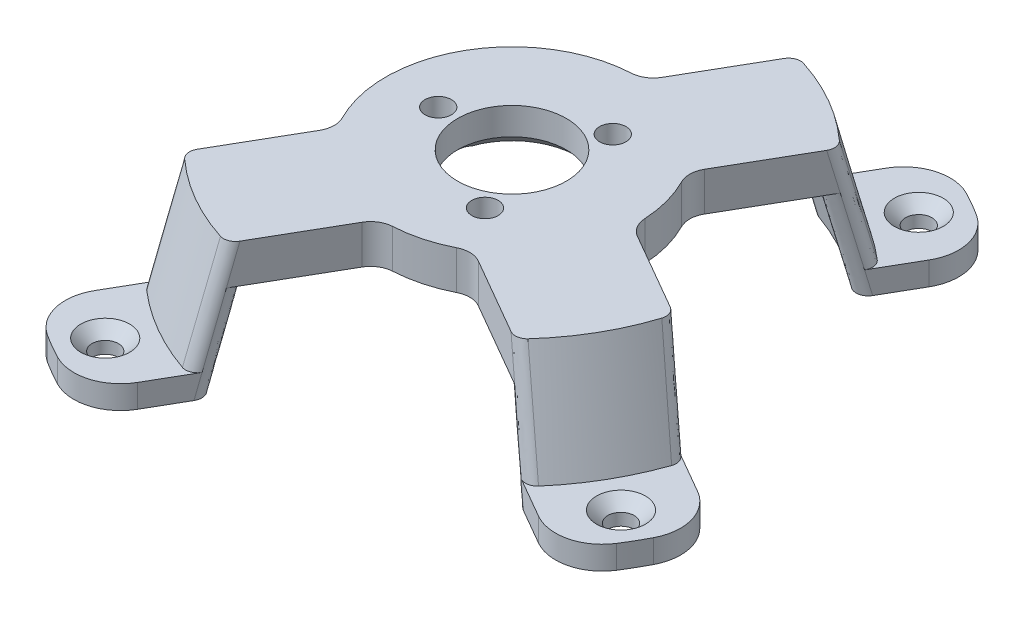
from build123d import *

# Parameters (mm, degrees)
SKETCH_2_R                   = 15.000000000000002
SKETCH_2_R_2                 = 7
EXTRUDE_1_DEPTH              = 5
SKETCH_3_R                   = 1.4999999999999987
CUT_EXTRUDE_1_DEPTH          = 5
PATTERN_CIRCULAR_1_COUNT     = 3
HOLE_WIZARD_M3_1_D           = 3.4
HOLE_WIZARD_M3_1_DEPTH       = 10
HOLE_WIZARD_M3_1_CSINK_D     = 6.3
HOLE_WIZARD_M3_1_CSINK_ANGLE = 90
HOLE_WIZARD_M3_1_TIP         = 1.0214630523468524
HOLE_WIZARD_M3_2_D           = 3.4
HOLE_WIZARD_M3_2_DEPTH       = 10
HOLE_WIZARD_M3_2_CSINK_D     = 6.3
HOLE_WIZARD_M3_2_CSINK_ANGLE = 90
HOLE_WIZARD_M3_2_TIP         = 1.0214630523468524
CUT_EXTRUDE_2_DEPTH          = 100
FILLET_1_R                   = 3
CHAMFER_1_SIZE               = 1.5
FILLET_2_R                   = 1.5
SKETCH_12_R                  = 1.5000000000000009
SKETCH_12_R_2                = 1.5000000000000042
SKETCH_12_R_3                = 1.4999999999999858
CUT_EXTRUDE_3_DEPTH          = 100
HOLE_WIZARD_M3_3_D           = 3.4
HOLE_WIZARD_M3_3_DEPTH       = 10
HOLE_WIZARD_M3_3_CSINK_D     = 6.3
HOLE_WIZARD_M3_3_CSINK_ANGLE = 90
HOLE_WIZARD_M3_3_TIP         = 1.0214630523468524
FILLET_3_R                   = 6


# Some blends are built 0.0001 mm under size
with BuildPart() as part:
    # ｽｹｯﾁ2 → ﾎﾞｽ - 押し出し1 (new body)
    with BuildSketch(Plane(origin=(0, 0, 0), x_dir=(1, 0, 0), z_dir=(0, 1, 0))):
        with Locations(Location((0, 0, 0), (0, 0, 270))):
            Circle(SKETCH_2_R)
        with Locations(Location((0, 0, 0), (0, 0, 270))):
            Circle(SKETCH_2_R_2, mode=Mode.SUBTRACT)
    extrude(amount=EXTRUDE_1_DEPTH)

    # ｽｹｯﾁ3 → ｶｯﾄ - 押し出し1 (cut)
    with BuildSketch(Plane(origin=(0, 5, 0), x_dir=(1, 0, 0), z_dir=(0, 1, 0))):
        with Locations(Location((-9.5, 0, 0), (0, 0, 270))):
            Circle(SKETCH_3_R)
    cut_extrude_1 = extrude(amount=-CUT_EXTRUDE_1_DEPTH, mode=Mode.SUBTRACT)

    # 円形ﾊﾟﾀｰﾝ1: ｶｯﾄ - 押し出し1 ×3 about axis
    pattern_circular_1_axis = Axis((4.7e-16, 0, 3.1e-16), (0, 1, 0))
    for i in range(1, PATTERN_CIRCULAR_1_COUNT):
        add(cut_extrude_1.rotate(pattern_circular_1_axis, i * 360 / PATTERN_CIRCULAR_1_COUNT), mode=Mode.SUBTRACT)

    # M3 丸皿ねじ用皿穴1
    with Locations(Plane(origin=(4.75, 0, 8.227241336), x_dir=(0, 0, -1), z_dir=(0, -1, 0))):
        with Locations((0, 0), (16.454482672, 0)):
            CounterSinkHole(HOLE_WIZARD_M3_1_D / 2, HOLE_WIZARD_M3_1_CSINK_D / 2, depth=HOLE_WIZARD_M3_1_DEPTH, counter_sink_angle=HOLE_WIZARD_M3_1_CSINK_ANGLE)
            with Locations((0, 0, -(HOLE_WIZARD_M3_1_DEPTH + HOLE_WIZARD_M3_1_TIP / 2))):  # 118° drill point
                Cone(0, HOLE_WIZARD_M3_1_D / 2, HOLE_WIZARD_M3_1_TIP, mode=Mode.SUBTRACT)

    # M3 丸皿ねじ用皿穴2
    with Locations(Plane(origin=(-9.5, 0, 0), x_dir=(0, 0, -1), z_dir=(0, -1, 0))):
        with Locations((0, 0)):
            CounterSinkHole(HOLE_WIZARD_M3_2_D / 2, HOLE_WIZARD_M3_2_CSINK_D / 2, depth=HOLE_WIZARD_M3_2_DEPTH, counter_sink_angle=HOLE_WIZARD_M3_2_CSINK_ANGLE)
            with Locations((0, 0, -(HOLE_WIZARD_M3_2_DEPTH + HOLE_WIZARD_M3_2_TIP / 2))):  # 118° drill point
                Cone(0, HOLE_WIZARD_M3_2_D / 2, HOLE_WIZARD_M3_2_TIP, mode=Mode.SUBTRACT)

    # ｽｹｯﾁ10 → 回転1 (revolve)
    with BuildSketch(Plane.XY, mode=Mode.PRIVATE) as revolve_1_sk:
        Polygon((29.841438454499965, 5.000000000000003), (15.000000000000002, 5), (15.000000000000002, 0), (28.000000000000004, 0), (31.000000000000004, -11.989999999999993), (43.34185546867846, -11.989999999999993), (43.34185546867846, -8.989999999999995), (33.341855468678446, -8.989999999999995), align=None)
    revolve(revolve_1_sk.sketch.rotate(Axis((-3.47e-15, 5, 0), (4.1e-16, -1, 0)), 180), axis=Axis((-3.47e-15, 5, 0), (4.1e-16, -1, 0)))

    # ｽｹｯﾁ11 → ｶｯﾄ - 押し出し2 (cut)
    with BuildSketch(Plane(origin=(0, 5, 0), x_dir=(1, 0, 0), z_dir=(0, 1, 0))):
        with BuildLine():
            ThreePointArc((-13.703042150052633, -8.734365222148707), (-14.072912811497138, 8.12499999999998), (0.71266109328574, 16.23436522214887))
            Line((0.7126610932858508, 16.234365222148742), (7.946601682364933, 28.763917861368522))
            ThreePointArc((7.946601682365226, 28.76391786136825), (-25.843443787066793, 14.920719227250016), (-20.936982739131317, -21.26391786136851))
            Line((-20.93698273913168, -21.26391786136839), (-13.703042150052537, -8.734365222148728))
        make_face()
        with BuildLine():
            ThreePointArc((-20.936982739131317, -21.26391786136851), (-25.843443787066793, 14.920719227250016), (7.946601682365226, 28.76391786136825))
            Line((7.946601682364933, 28.763917861368522), (14.848815863738722, 40.71890350823042))
            ThreePointArc((14.848815863738327, 40.718903508230746), (-37.53514788302896, 21.67092773433938), (-27.839196920506218, -33.218903508229914))
            Line((-27.83919692050553, -33.21890350823019), (-20.93698273913168, -21.26391786136839))
        make_face()
        with BuildLine():
            Line((27.839196920505294, 33.2189035082304), (20.936982739131395, 21.263917861368313))
            ThreePointArc((20.936982739131558, 21.263917861368263), (27.525453046829504, 11.526529555789693), (29.84143845449996, 0))
            ThreePointArc((29.84143845449996, -7.31e-15), (29.570831351215176, -4.0096611118271115), (28.76391786136822, -7.946601682365325))
            Line((28.76391786136849, -7.946601682365032), (40.71890350823052, -14.848815863738949))
            ThreePointArc((40.71890350823052, -14.848815863738949), (42.68108050509385, -7.539350262821762), (43.34185546867846, -1.062e-14))
            ThreePointArc((43.34185546867846, 0), (39.27543051807618, 18.32912963257075), (27.839196920505934, 33.21890350823016))
        make_face()
        with BuildLine():
            Line((20.936982739131395, 21.263917861368313), (13.703042150052372, 8.734365222148643))
            ThreePointArc((13.703042150052724, 8.734365222148572), (15.600271390882225, 4.54906941371767), (16.250000000000004, 0))
            ThreePointArc((16.250000000000004, -3.98e-15), (16.24609083533511, -0.35641628756369514), (16.234365222148842, -0.7126610932864834))
            Line((16.234365222149194, -0.712661093286167), (28.76391786136849, -7.946601682365032))
            ThreePointArc((28.76391786136822, -7.946601682365325), (29.570831351215176, -4.0096611118271115), (29.84143845449996, -7.31e-15))
            ThreePointArc((29.84143845449996, 0), (27.525453046829504, 11.526529555789693), (20.936982739131558, 21.263917861368263))
        make_face()
        with BuildLine():
            Line((33.218903508230504, -27.839196920505508), (21.26391786136825, -20.93698273913146))
            ThreePointArc((21.26391786136819, -20.936982739131636), (7.723532605278948, -28.824616096817355), (-7.946601682365455, -28.76391786136819))
            Line((-7.946601682365145, -28.763917861368473), (-14.848815863739018, -40.71890350823031))
            ThreePointArc((-14.848815863738585, -40.718903508230646), (11.217697645374956, -41.86501755648458), (33.218903508230504, -27.839196920505522))
        make_face()
        with BuildLine():
            Line((21.26391786136825, -20.93698273913146), (8.734365222148599, -13.7030421500524))
            ThreePointArc((8.734365222148528, -13.70304215005275), (4.2058094829155666, -15.696294677197466), (-0.7126610932863937, -16.234365222148842))
            Line((-0.7126610932861706, -16.234365222149094), (-7.946601682365145, -28.763917861368473))
            ThreePointArc((-7.946601682365455, -28.76391786136819), (7.723532605278948, -28.824616096817355), (21.26391786136819, -20.936982739131636))
        make_face()
    extrude(amount=-CUT_EXTRUDE_2_DEPTH, mode=Mode.SUBTRACT)

    # ﾌｨﾚｯﾄ1
    fillet_1_edges = [part.edges().sort_by_distance(p)[0] for p in [
        (-0.7126610932862826, 2.5, 16.234365222148966),
        (8.734365222148565, 2.5, 13.703042150052577),
        (0.7126610932857966, 2.5, -16.234365222148806),
        (-13.703042150052585, 2.5, 8.734365222148718),
        (16.23436522214902, 2.5, 0.7126610932863253),
        (13.703042150052548, 2.5, -8.734365222148607),
    ]]
    fillet(fillet_1_edges, radius=FILLET_1_R)

    # 面取り1
    # the kernel refuses this chamfer: 1.5 mm, written as the material it takes off along each edge
    with BuildSketch(Plane(origin=(0, 0, 0), x_dir=(0.7442189868674399, 0, -0.6679357001882752), z_dir=(0.6679357001882752, 0, 0.7442189868674399))) as chamfer_1_piece_1:
        Polygon((7.000000000000001, CHAMFER_1_SIZE), (7.000000000000001 + CHAMFER_1_SIZE, 0), (7.000000000000001, 0), align=None)
    revolve(axis=Axis((0, 0, 0), (0, 1, 0)), revolution_arc=156.18411921842153, mode=Mode.SUBTRACT)
    with BuildSketch(Plane(origin=(0, 0, 0), x_dir=(0.20633979101891303, 0, 0.9784803987011038), z_dir=(-0.9784803987011038, 0, 0.20633979101891303))) as chamfer_1_piece_2:
        Polygon((7, CHAMFER_1_SIZE), (7 + CHAMFER_1_SIZE, 0), (7, 0), align=None)
    revolve(axis=Axis((0, 0, 0), (0, 1, 0)), revolution_arc=156.18411921927228, mode=Mode.SUBTRACT)
    with BuildSketch(Plane(origin=(0, 0, 0), x_dir=(-0.9505825246393949, 0, -0.31047200171705375), z_dir=(0.31047200171705375, 0, -0.9505825246393949))) as chamfer_1_piece_3:
        Polygon((7.000000000000001, CHAMFER_1_SIZE), (7.000000000000001 + CHAMFER_1_SIZE, 0), (7.000000000000001, 0), align=None)
    revolve(axis=Axis((0, 0, 0), (0, 1, 0)), revolution_arc=108.08767779983522, mode=Mode.SUBTRACT)
    with BuildSketch(Plane(origin=(0, 0, 0), x_dir=(-1.8e-16, 0, 1), z_dir=(-1, 0, -1.8e-16))) as chamfer_1_piece_4:
        Polygon((7, CHAMFER_1_SIZE), (7 + CHAMFER_1_SIZE, 0), (7, 0), align=None)
    revolve(axis=Axis((0, 0, 0), (0, 1, 0)), revolution_arc=48.07893998206209, mode=Mode.SUBTRACT)

    # ﾌｨﾚｯﾄ2
    fillet_2_edges = [part.edges().sort_by_distance(p)[0] for p in [
        (-7.749054422575009, -5.83190834081924, 28.421755970515953),
        (-8.82257152167481, -1.7894546585643667, 30.28114212895074),
        (20.921755970515978, -5.831908340819197, 20.73943547934147),
        (22.78114212895078, -1.789454658564324, 21.81295257844127),
        (-20.739435479341555, -5.831908340819211, 20.921755970515893),
        (7.749054422574802, -5.831908340819183, -28.421755970516006),
        (8.8225715216746, -1.7894546585643525, -30.28114212895082),
        (-21.812952578441358, -1.7894546585642814, 22.78114212895068),
        (28.42175597051599, -5.831908340819268, 7.749054422574907),
        (30.281142128950776, -1.7894546585643667, 8.822571521674698),
        (20.739435479341406, -5.831908340819268, -20.92175597051604),
        (21.812952578441198, -1.7894546585643951, -22.781142128950844),
    ]]
    fillet(fillet_2_edges, radius=FILLET_2_R - 0.0001)  # a hair under: the kernel refuses the full size

    # ｽｹｯﾁ12 → ｶｯﾄ - 押し出し3 (cut)
    with BuildSketch(Plane(origin=(3.67e-15, -8.99000000000001, 0), x_dir=(1, 4.1e-16, 0), z_dir=(-4.1e-16, 1, 0))):
        with Locations(Location((19.170927734339145, 33.20502086410691, 0), (0, 0, 180))):
            Circle(SKETCH_12_R)
        with Locations(Location((-19.17092773433914, -33.20502086410691, 0), (0, 0, 180))):
            Circle(SKETCH_12_R_2)
        with Locations(Location((33.20502086410684, -19.170927734339262, 0), (0, 0, 180))):
            Circle(SKETCH_12_R_3)
    extrude(amount=-CUT_EXTRUDE_3_DEPTH, mode=Mode.SUBTRACT)

    # M3 丸皿ねじ用皿穴3
    with Locations(Plane(origin=(19.170927734, -8.99, -33.205020864), x_dir=(1, 0, 0), z_dir=(0, 1, 0))):
        with Locations((0, 0), (14.03409313, -52.375948598), (-38.341855468, -66.410041728)):
            CounterSinkHole(HOLE_WIZARD_M3_3_D / 2, HOLE_WIZARD_M3_3_CSINK_D / 2, depth=HOLE_WIZARD_M3_3_DEPTH, counter_sink_angle=HOLE_WIZARD_M3_3_CSINK_ANGLE)
            with Locations((0, 0, -(HOLE_WIZARD_M3_3_DEPTH + HOLE_WIZARD_M3_3_TIP / 2))):  # 118° drill point
                Cone(0, HOLE_WIZARD_M3_3_D / 2, HOLE_WIZARD_M3_3_TIP, mode=Mode.SUBTRACT)

    # ﾌｨﾚｯﾄ3
    fillet_3_edges = [part.edges().sort_by_distance(p)[0] for p in [
        (-14.848815863738803, -10.490000000000016, 40.71890350823048),
        (33.21890350823051, -10.489999999999998, 27.839196920505515),
        (-27.839196920505877, -10.490000000000023, 33.21890350823005),
        (14.848815863738526, -10.490000000000009, -40.71890350823058),
        (40.71890350823052, -10.489999999999995, 14.848815863738949),
        (27.83919692050561, -10.490000000000002, -33.21890350823028),
    ]]
    fillet(fillet_3_edges, radius=FILLET_3_R)


solid = part.part
